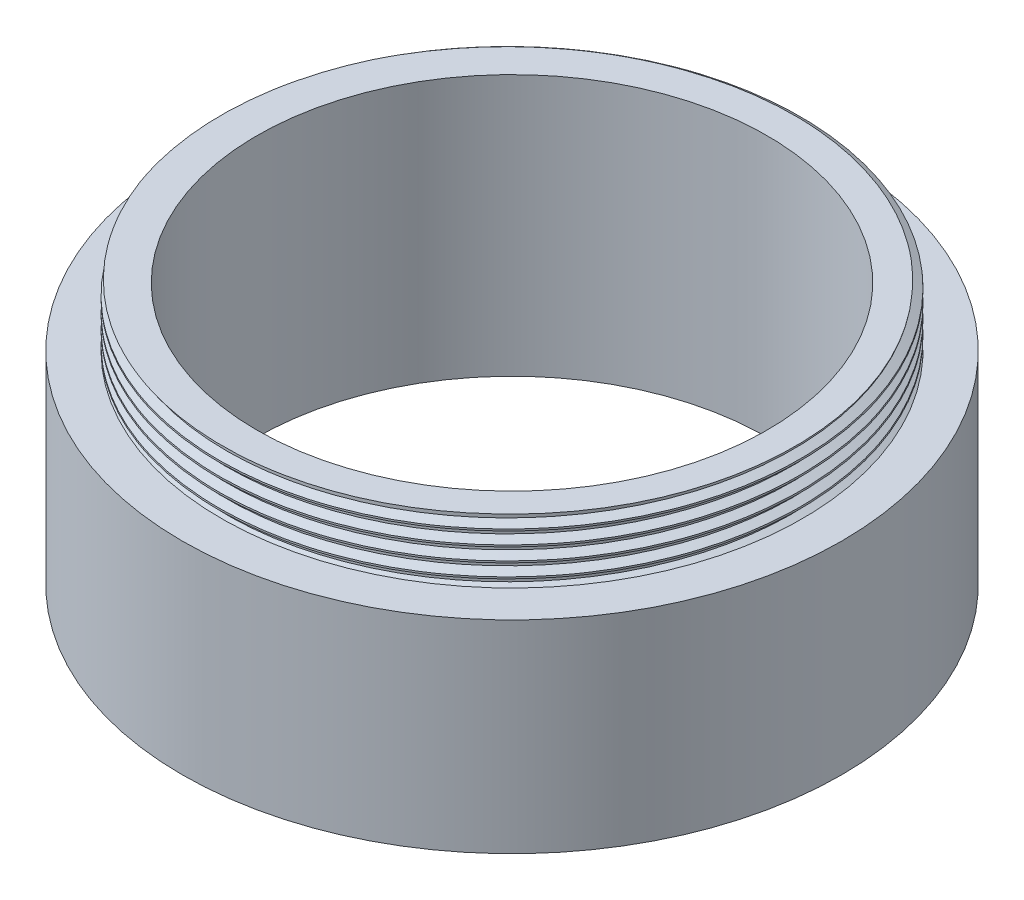
from build123d import *

# Parameters (mm, degrees)
SKETCH1_R           = 44.5
SKETCH1_R_2         = 39.06
BOSS_EXTRUDE1_DEPTH = 40
THREAD1_PITCH       = 2.116666667
SKETCH2_R           = 50.4825
SKETCH2_R_2         = 44.5
BOSS_EXTRUDE2_DEPTH = 31


with BuildPart() as part:
    # Sketch1 → Boss-Extrude1 (new body)
    with BuildSketch(Plane(origin=(0, 0, 0), x_dir=(1, 0, 0), z_dir=(0, 1, 0))):
        with Locations(Location((0, 0, 0), (0, 0, 270))):
            Circle(SKETCH1_R)
        with Locations(Location((0, 0, 0), (0, 0, 270))):
            Circle(SKETCH1_R_2, mode=Mode.SUBTRACT)
    extrude(amount=BOSS_EXTRUDE1_DEPTH)

    # Thread1: the profile of Thread Profile1 profile screwed along a right-hand helix of 5.905512 turns, 10 arcs to a turn; built about Z, then put on its axis
    thread1_z = Axis((0, 0, 0), (0, 0, 1))
    thread1_corners = [(44.5003, 0, -0.000173205), (44.5003, 0, 1.852256533), (43.354320565, 0, 1.190624997), (43.354320565, 0, 0.66145833)]
    with BuildLine(mode=Mode.PRIVATE) as thread1_profile:
        Line(thread1_corners[0], thread1_corners[1])
        Line(thread1_corners[1], thread1_corners[2])
        Line(thread1_corners[2], thread1_corners[3])
        Line(thread1_corners[3], thread1_corners[0])
    thread1_cap = Face(thread1_profile.wire())
    thread1_turn_angles = [0, 18, 36, 54, 72, 90, 108, 126, 144, 162, 180, 198, 216, 234, 252, 270, 288, 306, 324, 342, 360]
    thread1_turn_weights = [1, 0.9510565162951535, 1, 0.9510565162951535, 1, 0.9510565162951535, 1, 0.9510565162951535, 1, 0.9510565162951535, 1, 0.9510565162951535, 1, 0.9510565162951535, 1, 0.9510565162951535, 1, 0.9510565162951535, 1, 0.9510565162951535, 1]
    thread1_turn_rails = [Edge.make_bspline([Vector(p[0], p[1], 0).rotate(thread1_z, thread1_turn_angles[k]) / thread1_turn_weights[k] + Vector(0, 0, p[2] + THREAD1_PITCH * thread1_turn_angles[k] / 360) for k in range(21)], [0, 0, 0, 1, 1, 2, 2, 3, 3, 4, 4, 5, 5, 6, 6, 7, 7, 8, 8, 9, 9, 10, 10, 10], 2, thread1_turn_weights) for p in thread1_corners]
    thread1_turn_sides = [Face.make_surface_from_curves(thread1_turn_rails[p[0]], thread1_turn_rails[p[1]]) for p in [(0, 1), (1, 2), (2, 3), (3, 0)]]
    thread1_last_angles = [1800, 1818, 1836, 1854, 1872, 1890, 1908, 1926, 1944, 1962, 1980, 1998, 2016, 2034, 2052, 2070, 2088, 2106, 2124, 2124.992125984, 2125.984251969]
    thread1_last_weights = [1, 0.9510565162951535, 1, 0.9510565162951535, 1, 0.9510565162951535, 1, 0.9510565162951535, 1, 0.9510565162951535, 1, 0.9510565162951535, 1, 0.9510565162951535, 1, 0.9510565162951535, 1, 0.9510565162951535, 1, 0.9998500841552513, 1]
    thread1_last_rails = [Edge.make_bspline([Vector(p[0], p[1], 0).rotate(thread1_z, thread1_last_angles[k]) / thread1_last_weights[k] + Vector(0, 0, p[2] + THREAD1_PITCH * thread1_last_angles[k] / 360) for k in range(21)], [0, 0, 0, 1, 1, 2, 2, 3, 3, 4, 4, 5, 5, 6, 6, 7, 7, 8, 8, 9, 9, 10, 10, 10], 2, thread1_last_weights) for p in thread1_corners]
    thread1_last_sides = [Face.make_surface_from_curves(thread1_last_rails[p[0]], thread1_last_rails[p[1]]) for p in [(0, 1), (1, 2), (2, 3), (3, 0)]]
    thread1 = Plane(origin=(0, 42, 0), x_dir=(-1, 0, 0), z_dir=(0, -1, 0)) * Solid(Shell([*[p.moved(Location((0, 0, THREAD1_PITCH * i))) for i in range(5) for p in thread1_turn_sides], *thread1_last_sides, thread1_cap, thread1_cap.rotate(thread1_z, 2125.984251969).moved(Location((0, 0, THREAD1_PITCH * 2125.984251969 / 360)))]))
    add(thread1, mode=Mode.SUBTRACT)

    # Sketch2 → Boss-Extrude2 (add)
    with BuildSketch(Plane.XZ):
        with Locations(Location((0, 0, 0), (0, 0, 270))):
            Circle(SKETCH2_R)
        Circle(SKETCH2_R_2, mode=Mode.SUBTRACT)
    extrude(amount=-BOSS_EXTRUDE2_DEPTH)


solid = part.part
